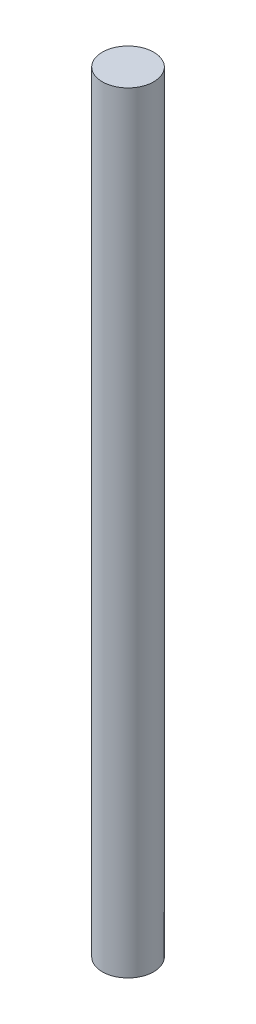
from build123d import *

# Parameters (mm, degrees)
SKETCH1_R           = 1.5
BOSS_EXTRUDE1_DEPTH = 45


with BuildPart() as part:
    # Sketch1 → Boss-Extrude1 (new body)
    with BuildSketch(Plane(origin=(0, 0, 0), x_dir=(1, 0, 0), z_dir=(0, 1, 0))):
        Circle(SKETCH1_R)
    extrude(amount=BOSS_EXTRUDE1_DEPTH)


solid = part.part
